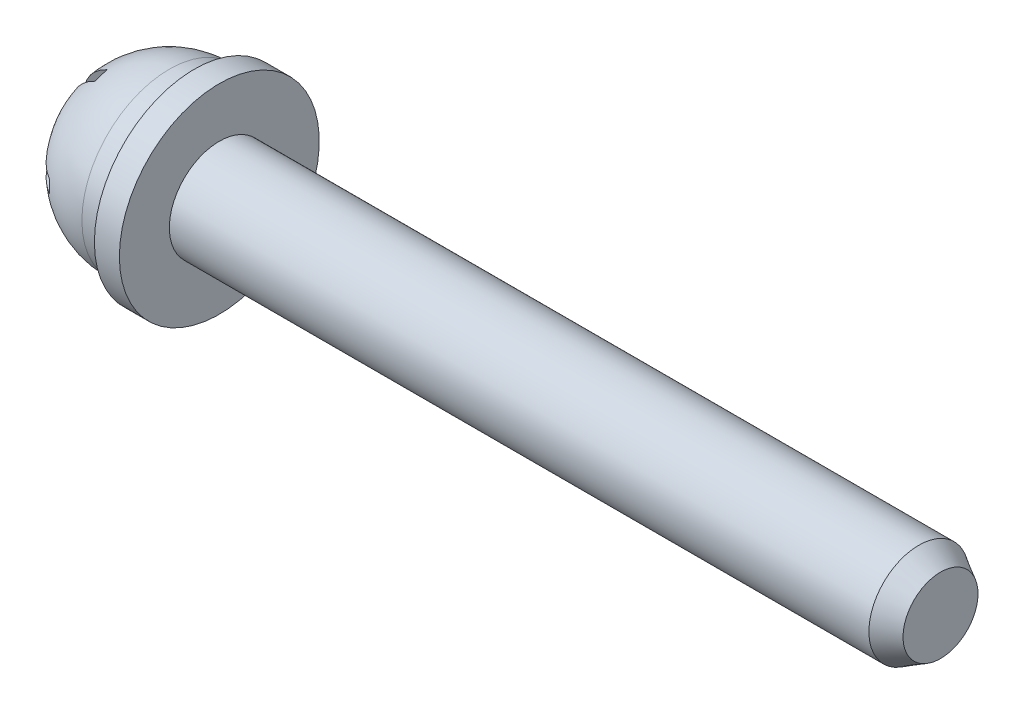
from build123d import *

# Parameters (mm, degrees)
SKETCH2_R               = 2
BOSS_EXTRUDE1_DEPTH     = 28.866025404
CUT_EXTRUDE1_REACH      = 33.38
CUT_EXTRUDE1_END_RADIUS = 3.5
CHAMFER1_SIZE           = 0.5
CHAMFER1_SIZE2          = 0.866025404
FILLET1_R               = 0.5


with BuildPart() as part:
    # Sketch1 → Revolve1 (revolve)
    with BuildSketch(Plane(origin=(0, 0, 0), x_dir=(-1, 0, 0), z_dir=(0, 0, -1)), mode=Mode.PRIVATE) as revolve1_sk:
        with BuildLine():
            Line((14, 4), (14, 0))
            Line((14, 0), (19.5, 0))
            ThreePointArc((19.5, 0), (18.474873734, 2.474873734), (16, 3.5))
            Line((16, 3.5), (15, 3.5))
            Line((15, 3.5), (15, 4))
            Line((15, 4), (14, 4))
        make_face()
    revolve(revolve1_sk.sketch.rotate(Axis((-14, 0, 0), (-1, 0, 0)), 270), axis=Axis((-14, 0, 0), (-1, 0, 0)))

    # Sketch2 → Boss-Extrude1 (add)
    with BuildSketch(Plane(origin=(-14, 0, 0), x_dir=(0, 0, -1), z_dir=(1, 0, 0))):
        Circle(SKETCH2_R)
    extrude(amount=BOSS_EXTRUDE1_DEPTH)

    # Cut-Extrude1: up to this sphere (the profile starts inside it)
    cut_extrude1_end = Location((-16, 0, 0)) * Sphere(CUT_EXTRUDE1_END_RADIUS, mode=Mode.PRIVATE)
    # Sketch3 → Cut-Extrude1 (cut, up to the surface)
    with BuildSketch(Plane(origin=(-16, 0, 0), x_dir=(0, 0, -1), z_dir=(1, 0, 0)), mode=Mode.PRIVATE) as cut_extrude1_sk1:
        with BuildLine():
            Line((2.267866263, 1.963869297), (0.134474286, 0.413869297))
            Line((0.134474286, 0.413869297), (-0.680408938, 2.921821979))
            ThreePointArc((-0.680408938, 2.921821979), (-0.927050983, 2.853169549), (-1.166941475, 2.763737975))
            Line((-1.166941475, 2.763737975), (-0.352058252, 0.255785292))
            Line((-0.352058252, 0.255785292), (-2.989075758, 0.255785292))
            ThreePointArc((-2.989075758, 0.255785292), (-3, 0), (-2.989075758, -0.255785292))
            Line((-2.989075758, -0.255785292), (-0.352058252, -0.255785292))
            Line((-0.352058252, -0.255785292), (-1.166941475, -2.763737975))
            ThreePointArc((-1.166941475, -2.763737975), (-0.927050983, -2.853169549), (-0.680408938, -2.921821979))
            Line((-0.680408938, -2.921821979), (0.134474286, -0.413869297))
            Line((0.134474286, -0.413869297), (2.267866263, -1.963869297))
            ThreePointArc((2.267866263, -1.963869297), (2.427050983, -1.763355757), (2.568559908, -1.55))
            Line((2.568559908, -1.55), (0.435167931, 0))
            Line((0.435167931, 0), (2.568559908, 1.55))
            ThreePointArc((2.568559908, 1.55), (2.427050983, 1.763355757), (2.267866263, 1.963869297))
        make_face()
    cut_extrude1_tool1 = extrude(cut_extrude1_sk1.sketch, amount=-CUT_EXTRUDE1_REACH, mode=Mode.PRIVATE) & cut_extrude1_end
    add(cut_extrude1_tool1.solids().sort_by_distance((-16, 0, 0))[0], mode=Mode.SUBTRACT)

    # Chamfer1
    chamfer1_edges = [part.edges().sort_by_distance(p)[0] for p in [
        (14.866025404, 0, 2),
    ]]
    chamfer1_side = [part.faces().sort_by_distance(p)[0] for p in [
        (14.866025404, 0, 0),
    ]]
    chamfer(chamfer1_edges, length=CHAMFER1_SIZE, length2=CHAMFER1_SIZE2, reference=chamfer1_side[0])

    # Fillet1
    # the kernel refuses this fillet: 0.5 mm, written as the material it takes off along each edge
    with BuildSketch(Plane(origin=(-16, 0, -0.435167931), x_dir=(0, -0.5877852522924764, -0.8090169943749451), z_dir=(-1, 0, 0)), Plane(origin=(-16, -0.413869297, -0.134474286), x_dir=(0, -0.9510565162951523, 0.3090169943749514), z_dir=(-1, 0, 0)), Plane(origin=(-16, -0.255785292, 0.352058252), x_dir=(0, 0, 1), z_dir=(-1, 0, 0)), Plane(origin=(-16, 0.255785292, 0.352058252), x_dir=(0, 0.9510565162951548, 0.3090169943749436), z_dir=(-1, 0, 0)), Plane(origin=(-16, 0.413869297, -0.134474286), x_dir=(0, 0.5877852522924701, -0.8090169943749497), z_dir=(-1, 0, 0))) as fillet1_piece_1:
        with BuildLine():
            CenterArc((FILLET1_R * 1.37638192047, -FILLET1_R), FILLET1_R, 90, 108)
            Line((FILLET1_R * 0.425325404176, -FILLET1_R * 1.30901699437), (0, 0))
            Line((0, 0), (FILLET1_R * 1.37638192047, 0))
        make_face()
    extrude(amount=5.193319014, mode=Mode.SUBTRACT)


solid = part.part
